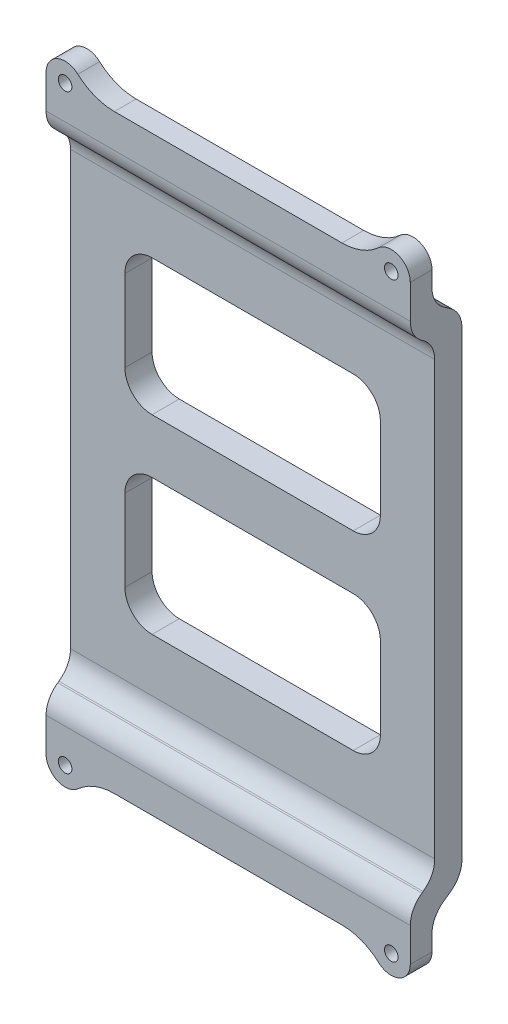
from build123d import *

# Parameters (mm, degrees)
SKETCH1_R                    = 3.5
SKETCH1_R_2                  = 1.25
MOUNTING_BOSSES_DEPTH        = 4
MOUNTING_BOSSES_2_DEPTH      = 4
MOUNTING_BOSSES_3_DEPTH      = 4
MOUNTING_BOSSES_4_DEPTH      = 4
MATERIAL_BULK_DEPTH          = 33.5
SKETCH5_R                    = 1.25
MOUNT_POINT_CUT_REPEAT_DEPTH = 67
WEIGHT_RELIEF_DEPTH          = 67
FILLET2_R                    = 5
FILLET3_R                    = 10


with BuildPart() as part:
    # Sketch1 → MOUNTING BOSSES (new body)
    with BuildSketch(Plane.XY):
        with Locations((-30, 54.33)):
            Circle(SKETCH1_R)
        with Locations((-30, 54.33)):
            Circle(SKETCH1_R_2, mode=Mode.SUBTRACT)
    extrude(amount=MOUNTING_BOSSES_DEPTH)



with BuildPart() as body_2:
    # Sketch1 → MOUNTING BOSSES 2 (new body)
    with BuildSketch(Plane.XY):
        with Locations((30, 54.33)):
            Circle(SKETCH1_R)
        with Locations((30, 54.33)):
            Circle(SKETCH1_R_2, mode=Mode.SUBTRACT)
    extrude(amount=MOUNTING_BOSSES_2_DEPTH)


with BuildPart() as body_3:
    # Sketch1 → MOUNTING BOSSES 3 (new body)
    with BuildSketch(Plane.XY):
        with Locations((30, -54.33)):
            Circle(SKETCH1_R)
        with Locations((30, -54.33)):
            Circle(SKETCH1_R_2, mode=Mode.SUBTRACT)
    extrude(amount=MOUNTING_BOSSES_3_DEPTH)


with BuildPart() as body_4:
    # Sketch1 → MOUNTING BOSSES 4 (new body)
    with BuildSketch(Plane.XY):
        with Locations((-30, -54.33)):
            Circle(SKETCH1_R)
        with Locations((-30, -54.33)):
            Circle(SKETCH1_R_2, mode=Mode.SUBTRACT)
    extrude(amount=MOUNTING_BOSSES_4_DEPTH)


with BuildPart() as part_1:
    add(part.part)

    add(body_2.part)  # MATERIAL BULK merges body 2

    add(body_3.part)  # MATERIAL BULK merges body 3

    add(body_4.part)  # MATERIAL BULK merges body 4
    # Sketch4 → MATERIAL BULK (add, symmetric)
    with BuildSketch(Plane(origin=(0, 0, 0), x_dir=(0, 0, -1), z_dir=(1, 0, 0))):
        Polygon((-4, 54.33), (-4, 45.522585119), (0.5, 42.388948755), (0.5, -42.388948755), (-4, -45.522585119), (-4, -54.33), (0, -54.33), (0, -48.83), (5.5, -45), (5.5, 45), (0, 48.83), (0, 54.33), align=None)
    extrude(amount=MATERIAL_BULK_DEPTH, both=True)

    # Sketch5 → MOUNT POINT CUT REPEAT (cut)
    with BuildSketch(Plane.XY):
        with Locations((-30, 54.33)):
            Circle(SKETCH5_R)
        with Locations((30, 54.33)):
            Circle(SKETCH5_R)
        with Locations((30, -54.33)):
            Circle(SKETCH5_R)
        with Locations((-30, -54.33)):
            Circle(SKETCH5_R)
    extrude(amount=MOUNT_POINT_CUT_REPEAT_DEPTH, mode=Mode.SUBTRACT)

    # Sketch6 → WEIGHT RELIEF (cut)
    with BuildSketch(Plane.XY):
        with BuildLine():
            Line((-18.5, 30), (18.5, 30))
            ThreePointArc((18.5, 30), (22.035533906, 28.535533906), (23.5, 25))
            Line((23.5, 25), (23.5, 10))
            ThreePointArc((23.5, 10), (22.035533906, 6.464466094), (18.5, 5))
            Line((18.5, 5), (-18.5, 5))
            ThreePointArc((-18.5, 5), (-22.035533906, 6.464466094), (-23.5, 10))
            Line((-23.5, 10), (-23.5, 25))
            ThreePointArc((-23.5, 25), (-22.035533906, 28.535533906), (-18.5, 30))
        make_face()
        with BuildLine():
            Line((-18.5, -5), (18.5, -5))
            ThreePointArc((18.5, -5), (22.035533906, -6.464466094), (23.5, -10))
            Line((23.5, -10), (23.5, -25))
            ThreePointArc((23.5, -25), (22.035533906, -28.535533906), (18.5, -30))
            Line((18.5, -30), (-18.5, -30))
            ThreePointArc((-18.5, -30), (-22.035533906, -28.535533906), (-23.5, -25))
            Line((-23.5, -25), (-23.5, -10))
            ThreePointArc((-23.5, -10), (-22.035533906, -6.464466094), (-18.5, -5))
        make_face()
    extrude(amount=-WEIGHT_RELIEF_DEPTH, mode=Mode.SUBTRACT)

    # Fillet2
    fillet2_edges = [part_1.edges().sort_by_distance(p)[0] for p in [
        (0, -45, -5.5),
        (0, -48.83, 0),
        (0, -45.522585119, 4),
        (0, -42.388948755, -0.5),
        (0, 42.388948755, -0.5),
        (0, 45.522585119, 4),
        (0, 45, -5.5),
        (0, 48.83, 0),
    ]]
    fillet(fillet2_edges, radius=FILLET2_R)

    # Fillet3
    fillet3_edges = [part_1.edges().sort_by_distance(p)[0] for p in [
        (-26.5, -54.33, 2),
        (26.5, -54.33, 2),
        (-26.5, 54.33, 2),
        (26.5, 54.33, 2),
    ]]
    fillet(fillet3_edges, radius=FILLET3_R)


solid = part_1.part
